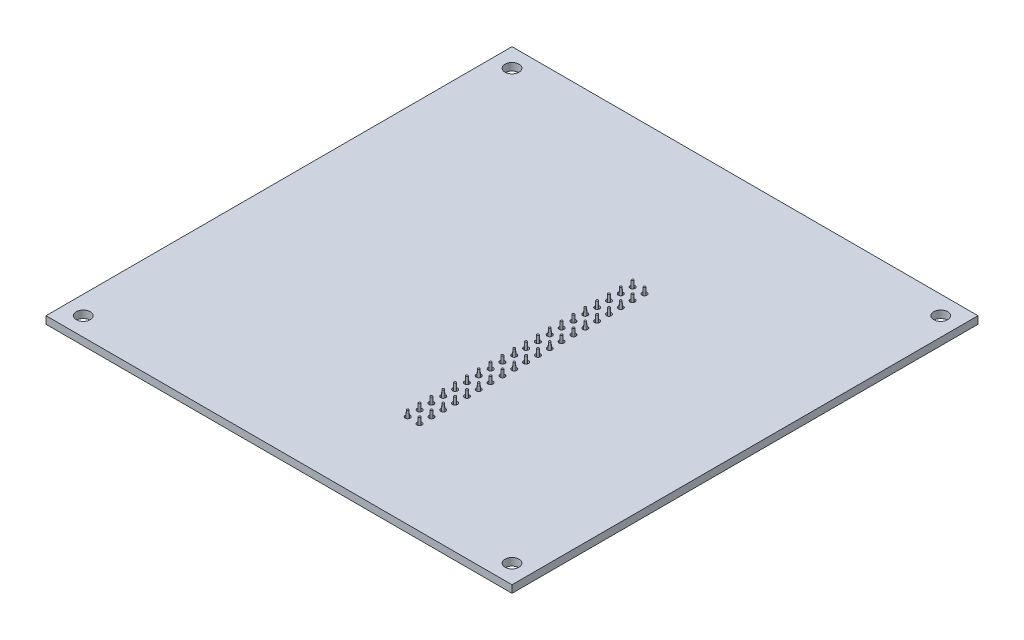
from build123d import *

# Parameters (mm, degrees)
SKETCH1_W               = 100
SKETCH1_H               = 100
BOSS_EXTRUDE1_DEPTH     = 1.6
SKETCH2_R               = 0.535
CUT_EXTRUDE1_DEPTH      = 71.728777736
SKETCH4_W               = 2.54
SKETCH4_H               = 2.54
SKETCH4_W_2             = 1.54
SKETCH4_H_2             = 1.54
BOSS_EXTRUDE2_DEPTH     = 8.4
LPATTERN2_COUNT         = 20
LPATTERN2_PITCH         = 2.54
LPATTERN2_COUNT_DIR2    = 2
LPATTERN2_PITCH_DIR2    = 2.54
SKETCH5_R               = 0.535
BOSS_EXTRUDE3_DEPTH     = 12.3
BOSS_EXTRUDE3_TAPER     = 1.5
BOSS_EXTRUDE3_2_DEPTH   = 12.3
BOSS_EXTRUDE3_2_TAPER   = 1.5
BOSS_EXTRUDE3_3_DEPTH   = 12.3
BOSS_EXTRUDE3_3_TAPER   = 1.5
BOSS_EXTRUDE3_4_DEPTH   = 12.3
BOSS_EXTRUDE3_4_TAPER   = 1.5
BOSS_EXTRUDE3_5_DEPTH   = 12.3
BOSS_EXTRUDE3_5_TAPER   = 1.5
BOSS_EXTRUDE3_6_DEPTH   = 12.3
BOSS_EXTRUDE3_6_TAPER   = 1.5
BOSS_EXTRUDE3_7_DEPTH   = 12.3
BOSS_EXTRUDE3_7_TAPER   = 1.5
BOSS_EXTRUDE3_8_DEPTH   = 12.3
BOSS_EXTRUDE3_8_TAPER   = 1.5
BOSS_EXTRUDE3_9_DEPTH   = 12.3
BOSS_EXTRUDE3_9_TAPER   = 1.5
BOSS_EXTRUDE3_10_DEPTH  = 12.3
BOSS_EXTRUDE3_10_TAPER  = 1.5
BOSS_EXTRUDE3_11_DEPTH  = 12.3
BOSS_EXTRUDE3_11_TAPER  = 1.5
BOSS_EXTRUDE3_12_DEPTH  = 12.3
BOSS_EXTRUDE3_12_TAPER  = 1.5
BOSS_EXTRUDE3_13_DEPTH  = 12.3
BOSS_EXTRUDE3_13_TAPER  = 1.5
BOSS_EXTRUDE3_14_DEPTH  = 12.3
BOSS_EXTRUDE3_14_TAPER  = 1.5
BOSS_EXTRUDE3_15_DEPTH  = 12.3
BOSS_EXTRUDE3_15_TAPER  = 1.5
BOSS_EXTRUDE3_16_DEPTH  = 12.3
BOSS_EXTRUDE3_16_TAPER  = 1.5
BOSS_EXTRUDE3_17_DEPTH  = 12.3
BOSS_EXTRUDE3_17_TAPER  = 1.5
BOSS_EXTRUDE3_18_DEPTH  = 12.3
BOSS_EXTRUDE3_18_TAPER  = 1.5
BOSS_EXTRUDE3_19_DEPTH  = 12.3
BOSS_EXTRUDE3_19_TAPER  = 1.5
BOSS_EXTRUDE3_20_DEPTH  = 12.3
BOSS_EXTRUDE3_20_TAPER  = 1.5
BOSS_EXTRUDE3_21_DEPTH  = 12.3
BOSS_EXTRUDE3_21_TAPER  = 1.5
BOSS_EXTRUDE3_22_DEPTH  = 12.3
BOSS_EXTRUDE3_22_TAPER  = 1.5
BOSS_EXTRUDE3_23_DEPTH  = 12.3
BOSS_EXTRUDE3_23_TAPER  = 1.5
BOSS_EXTRUDE3_24_DEPTH  = 12.3
BOSS_EXTRUDE3_24_TAPER  = 1.5
BOSS_EXTRUDE3_25_DEPTH  = 12.3
BOSS_EXTRUDE3_25_TAPER  = 1.5
BOSS_EXTRUDE3_26_DEPTH  = 12.3
BOSS_EXTRUDE3_26_TAPER  = 1.5
BOSS_EXTRUDE3_27_DEPTH  = 12.3
BOSS_EXTRUDE3_27_TAPER  = 1.5
BOSS_EXTRUDE3_28_DEPTH  = 12.3
BOSS_EXTRUDE3_28_TAPER  = 1.5
BOSS_EXTRUDE3_29_DEPTH  = 12.3
BOSS_EXTRUDE3_29_TAPER  = 1.5
BOSS_EXTRUDE3_30_DEPTH  = 12.3
BOSS_EXTRUDE3_30_TAPER  = 1.5
BOSS_EXTRUDE3_31_DEPTH  = 12.3
BOSS_EXTRUDE3_31_TAPER  = 1.5
BOSS_EXTRUDE3_32_DEPTH  = 12.3
BOSS_EXTRUDE3_32_TAPER  = 1.5
BOSS_EXTRUDE3_33_DEPTH  = 12.3
BOSS_EXTRUDE3_33_TAPER  = 1.5
BOSS_EXTRUDE3_34_DEPTH  = 12.3
BOSS_EXTRUDE3_34_TAPER  = 1.5
BOSS_EXTRUDE3_35_DEPTH  = 12.3
BOSS_EXTRUDE3_35_TAPER  = 1.5
BOSS_EXTRUDE3_36_DEPTH  = 12.3
BOSS_EXTRUDE3_36_TAPER  = 1.5
BOSS_EXTRUDE3_37_DEPTH  = 12.3
BOSS_EXTRUDE3_37_TAPER  = 1.5
BOSS_EXTRUDE3_38_DEPTH  = 12.3
BOSS_EXTRUDE3_38_TAPER  = 1.5
BOSS_EXTRUDE3_39_DEPTH  = 12.3
BOSS_EXTRUDE3_39_TAPER  = 1.5
BOSS_EXTRUDE3_40_DEPTH  = 12.3
BOSS_EXTRUDE3_40_TAPER  = 1.5
CUT_EXTRUDE2_DEPTH      = 74.323666029
CUT_EXTRUDE2_DEPTH_BACK = 74.323666029
SKETCH6_R               = 1.5


with BuildPart() as part:
    # Sketch1 → Boss-Extrude1 (new body)
    with BuildSketch(Plane(origin=(0, 0, 0), x_dir=(1, 0, 0), z_dir=(0, 1, 0))):
        Rectangle(SKETCH1_W, SKETCH1_H)
    extrude(amount=BOSS_EXTRUDE1_DEPTH)

    # Sketch2 → Cut-Extrude1 (cut, through all)
    with BuildSketch(Plane(origin=(0, 1.6, 0), x_dir=(1, 0, 0), z_dir=(0, 1, 0))):
        with Locations((10.138, -29.974)):
            Circle(SKETCH2_R)
        with Locations((7.598, -29.974)):
            Circle(SKETCH2_R)
        with Locations((7.598, -27.434)):
            Circle(SKETCH2_R)
        with Locations((7.598, -24.894)):
            Circle(SKETCH2_R)
        with Locations((7.598, -22.354)):
            Circle(SKETCH2_R)
        with Locations((7.598, -19.814)):
            Circle(SKETCH2_R)
        with Locations((7.598, -17.274)):
            Circle(SKETCH2_R)
        with Locations((7.598, -14.734)):
            Circle(SKETCH2_R)
        with Locations((7.598, -12.194)):
            Circle(SKETCH2_R)
        with Locations((7.598, -9.654)):
            Circle(SKETCH2_R)
        with Locations((7.598, -7.114)):
            Circle(SKETCH2_R)
        with Locations((7.598, -4.574)):
            Circle(SKETCH2_R)
        with Locations((7.598, -2.034)):
            Circle(SKETCH2_R)
        with Locations((7.598, 0.506)):
            Circle(SKETCH2_R)
        with Locations((7.598, 3.046)):
            Circle(SKETCH2_R)
        with Locations((7.598, 5.586)):
            Circle(SKETCH2_R)
        with Locations((7.598, 8.126)):
            Circle(SKETCH2_R)
        with Locations((7.598, 10.666)):
            Circle(SKETCH2_R)
        with Locations((7.598, 13.206)):
            Circle(SKETCH2_R)
        with Locations((7.598, 15.746)):
            Circle(SKETCH2_R)
        with Locations((7.598, 18.286)):
            Circle(SKETCH2_R)
        with Locations((10.138, -27.434)):
            Circle(SKETCH2_R)
        with Locations((10.138, -24.894)):
            Circle(SKETCH2_R)
        with Locations((10.138, -22.354)):
            Circle(SKETCH2_R)
        with Locations((10.138, -19.814)):
            Circle(SKETCH2_R)
        with Locations((10.138, -17.274)):
            Circle(SKETCH2_R)
        with Locations((10.138, -14.734)):
            Circle(SKETCH2_R)
        with Locations((10.138, -12.194)):
            Circle(SKETCH2_R)
        with Locations((10.138, -9.654)):
            Circle(SKETCH2_R)
        with Locations((10.138, -7.114)):
            Circle(SKETCH2_R)
        with Locations((10.138, -4.574)):
            Circle(SKETCH2_R)
        with Locations((10.138, -2.034)):
            Circle(SKETCH2_R)
        with Locations((10.138, 0.506)):
            Circle(SKETCH2_R)
        with Locations((10.138, 3.046)):
            Circle(SKETCH2_R)
        with Locations((10.138, 5.586)):
            Circle(SKETCH2_R)
        with Locations((10.138, 8.126)):
            Circle(SKETCH2_R)
        with Locations((10.138, 10.666)):
            Circle(SKETCH2_R)
        with Locations((10.138, 13.206)):
            Circle(SKETCH2_R)
        with Locations((10.138, 15.746)):
            Circle(SKETCH2_R)
        with Locations((10.138, 18.286)):
            Circle(SKETCH2_R)
    extrude(amount=-CUT_EXTRUDE1_DEPTH, mode=Mode.SUBTRACT)

    # Sketch6 → Cut-Extrude2 (cut, two sides: drawn at the far end of the back side and taken through both)
    with BuildSketch(Plane(origin=(0, 1.6, 0), x_dir=(1, 0, 0), z_dir=(0, 1, 0)).offset(-CUT_EXTRUDE2_DEPTH_BACK)):
        with Locations((-46, 46)):
            Circle(SKETCH6_R)
        with Locations((-46, -46)):
            Circle(SKETCH6_R)
        with Locations((46, -46)):
            Circle(SKETCH6_R)
        with Locations((46, 46)):
            Circle(SKETCH6_R)
    extrude(amount=CUT_EXTRUDE2_DEPTH + CUT_EXTRUDE2_DEPTH_BACK, mode=Mode.SUBTRACT)


with BuildPart() as body_2:
    # Sketch4 → Boss-Extrude2 (new body)
    with BuildSketch(Plane(origin=(0, -9.4, 0), x_dir=(1, 0, 0), z_dir=(0, 1, 0))):
        with Locations((10.138, -29.974)):
            Rectangle(SKETCH4_W, SKETCH4_H)
        with Locations((10.138, -29.974)):
            Rectangle(SKETCH4_W_2, SKETCH4_H_2, mode=Mode.SUBTRACT)
    boss_extrude2 = extrude(amount=-BOSS_EXTRUDE2_DEPTH)

    # LPattern2: Boss-Extrude2 20 × 2
    with Locations(*[(-j * LPATTERN2_PITCH_DIR2, 0, -i * LPATTERN2_PITCH) for i in range(LPATTERN2_COUNT) for j in range(LPATTERN2_COUNT_DIR2) if (i, j) != (0, 0)]):
        add(boss_extrude2)


with BuildPart() as body_3:
    # Sketch5 → Boss-Extrude3 (new body)
    with BuildSketch(Plane(origin=(0, -9.4, 0), x_dir=(-1, 0, 0), z_dir=(0, -1, 0))):
        with Locations((-7.598, 3.046)):
            Circle(SKETCH5_R)
    extrude(amount=-BOSS_EXTRUDE3_DEPTH, taper=BOSS_EXTRUDE3_TAPER)


with BuildPart() as body_4:
    # Sketch5 → Boss-Extrude3 2 (new body)
    with BuildSketch(Plane(origin=(0, -9.4, 0), x_dir=(-1, 0, 0), z_dir=(0, -1, 0))):
        with Locations((-7.598, 5.586)):
            Circle(SKETCH5_R)
    extrude(amount=-BOSS_EXTRUDE3_2_DEPTH, taper=BOSS_EXTRUDE3_2_TAPER)


with BuildPart() as body_5:
    # Sketch5 → Boss-Extrude3 3 (new body)
    with BuildSketch(Plane(origin=(0, -9.4, 0), x_dir=(-1, 0, 0), z_dir=(0, -1, 0))):
        with Locations((-7.598, 8.126)):
            Circle(SKETCH5_R)
    extrude(amount=-BOSS_EXTRUDE3_3_DEPTH, taper=BOSS_EXTRUDE3_3_TAPER)


with BuildPart() as body_6:
    # Sketch5 → Boss-Extrude3 4 (new body)
    with BuildSketch(Plane(origin=(0, -9.4, 0), x_dir=(-1, 0, 0), z_dir=(0, -1, 0))):
        with Locations((-7.598, 10.666)):
            Circle(SKETCH5_R)
    extrude(amount=-BOSS_EXTRUDE3_4_DEPTH, taper=BOSS_EXTRUDE3_4_TAPER)


with BuildPart() as body_7:
    # Sketch5 → Boss-Extrude3 5 (new body)
    with BuildSketch(Plane(origin=(0, -9.4, 0), x_dir=(-1, 0, 0), z_dir=(0, -1, 0))):
        with Locations((-7.598, 13.206)):
            Circle(SKETCH5_R)
    extrude(amount=-BOSS_EXTRUDE3_5_DEPTH, taper=BOSS_EXTRUDE3_5_TAPER)


with BuildPart() as body_8:
    # Sketch5 → Boss-Extrude3 6 (new body)
    with BuildSketch(Plane(origin=(0, -9.4, 0), x_dir=(-1, 0, 0), z_dir=(0, -1, 0))):
        with Locations((-7.598, 15.746)):
            Circle(SKETCH5_R)
    extrude(amount=-BOSS_EXTRUDE3_6_DEPTH, taper=BOSS_EXTRUDE3_6_TAPER)


with BuildPart() as body_9:
    # Sketch5 → Boss-Extrude3 7 (new body)
    with BuildSketch(Plane(origin=(0, -9.4, 0), x_dir=(-1, 0, 0), z_dir=(0, -1, 0))):
        with Locations((-7.598, 18.286)):
            Circle(SKETCH5_R)
    extrude(amount=-BOSS_EXTRUDE3_7_DEPTH, taper=BOSS_EXTRUDE3_7_TAPER)


with BuildPart() as body_10:
    # Sketch5 → Boss-Extrude3 8 (new body)
    with BuildSketch(Plane(origin=(0, -9.4, 0), x_dir=(-1, 0, 0), z_dir=(0, -1, 0))):
        with Locations((-10.138, 18.286)):
            Circle(SKETCH5_R)
    extrude(amount=-BOSS_EXTRUDE3_8_DEPTH, taper=BOSS_EXTRUDE3_8_TAPER)


with BuildPart() as body_11:
    # Sketch5 → Boss-Extrude3 9 (new body)
    with BuildSketch(Plane(origin=(0, -9.4, 0), x_dir=(-1, 0, 0), z_dir=(0, -1, 0))):
        with Locations((-10.138, 15.746)):
            Circle(SKETCH5_R)
    extrude(amount=-BOSS_EXTRUDE3_9_DEPTH, taper=BOSS_EXTRUDE3_9_TAPER)


with BuildPart() as body_12:
    # Sketch5 → Boss-Extrude3 10 (new body)
    with BuildSketch(Plane(origin=(0, -9.4, 0), x_dir=(-1, 0, 0), z_dir=(0, -1, 0))):
        with Locations((-10.138, 13.206)):
            Circle(SKETCH5_R)
    extrude(amount=-BOSS_EXTRUDE3_10_DEPTH, taper=BOSS_EXTRUDE3_10_TAPER)


with BuildPart() as body_13:
    # Sketch5 → Boss-Extrude3 11 (new body)
    with BuildSketch(Plane(origin=(0, -9.4, 0), x_dir=(-1, 0, 0), z_dir=(0, -1, 0))):
        with Locations((-10.138, 10.666)):
            Circle(SKETCH5_R)
    extrude(amount=-BOSS_EXTRUDE3_11_DEPTH, taper=BOSS_EXTRUDE3_11_TAPER)


with BuildPart() as body_14:
    # Sketch5 → Boss-Extrude3 12 (new body)
    with BuildSketch(Plane(origin=(0, -9.4, 0), x_dir=(-1, 0, 0), z_dir=(0, -1, 0))):
        with Locations((-10.138, 8.126)):
            Circle(SKETCH5_R)
    extrude(amount=-BOSS_EXTRUDE3_12_DEPTH, taper=BOSS_EXTRUDE3_12_TAPER)


with BuildPart() as body_15:
    # Sketch5 → Boss-Extrude3 13 (new body)
    with BuildSketch(Plane(origin=(0, -9.4, 0), x_dir=(-1, 0, 0), z_dir=(0, -1, 0))):
        with Locations((-10.138, 5.586)):
            Circle(SKETCH5_R)
    extrude(amount=-BOSS_EXTRUDE3_13_DEPTH, taper=BOSS_EXTRUDE3_13_TAPER)


with BuildPart() as body_16:
    # Sketch5 → Boss-Extrude3 14 (new body)
    with BuildSketch(Plane(origin=(0, -9.4, 0), x_dir=(-1, 0, 0), z_dir=(0, -1, 0))):
        with Locations((-10.138, 3.046)):
            Circle(SKETCH5_R)
    extrude(amount=-BOSS_EXTRUDE3_14_DEPTH, taper=BOSS_EXTRUDE3_14_TAPER)


with BuildPart() as body_17:
    # Sketch5 → Boss-Extrude3 15 (new body)
    with BuildSketch(Plane(origin=(0, -9.4, 0), x_dir=(-1, 0, 0), z_dir=(0, -1, 0))):
        with Locations((-7.598, 0.506)):
            Circle(SKETCH5_R)
    extrude(amount=-BOSS_EXTRUDE3_15_DEPTH, taper=BOSS_EXTRUDE3_15_TAPER)


with BuildPart() as body_18:
    # Sketch5 → Boss-Extrude3 16 (new body)
    with BuildSketch(Plane(origin=(0, -9.4, 0), x_dir=(-1, 0, 0), z_dir=(0, -1, 0))):
        with Locations((-10.138, 0.506)):
            Circle(SKETCH5_R)
    extrude(amount=-BOSS_EXTRUDE3_16_DEPTH, taper=BOSS_EXTRUDE3_16_TAPER)


with BuildPart() as body_19:
    # Sketch5 → Boss-Extrude3 17 (new body)
    with BuildSketch(Plane(origin=(0, -9.4, 0), x_dir=(-1, 0, 0), z_dir=(0, -1, 0))):
        with Locations((-10.138, -2.034)):
            Circle(SKETCH5_R)
    extrude(amount=-BOSS_EXTRUDE3_17_DEPTH, taper=BOSS_EXTRUDE3_17_TAPER)


with BuildPart() as body_20:
    # Sketch5 → Boss-Extrude3 18 (new body)
    with BuildSketch(Plane(origin=(0, -9.4, 0), x_dir=(-1, 0, 0), z_dir=(0, -1, 0))):
        with Locations((-7.598, -2.034)):
            Circle(SKETCH5_R)
    extrude(amount=-BOSS_EXTRUDE3_18_DEPTH, taper=BOSS_EXTRUDE3_18_TAPER)


with BuildPart() as body_21:
    # Sketch5 → Boss-Extrude3 19 (new body)
    with BuildSketch(Plane(origin=(0, -9.4, 0), x_dir=(-1, 0, 0), z_dir=(0, -1, 0))):
        with Locations((-7.598, -4.574)):
            Circle(SKETCH5_R)
    extrude(amount=-BOSS_EXTRUDE3_19_DEPTH, taper=BOSS_EXTRUDE3_19_TAPER)


with BuildPart() as body_22:
    # Sketch5 → Boss-Extrude3 20 (new body)
    with BuildSketch(Plane(origin=(0, -9.4, 0), x_dir=(-1, 0, 0), z_dir=(0, -1, 0))):
        with Locations((-10.138, -4.574)):
            Circle(SKETCH5_R)
    extrude(amount=-BOSS_EXTRUDE3_20_DEPTH, taper=BOSS_EXTRUDE3_20_TAPER)


with BuildPart() as body_23:
    # Sketch5 → Boss-Extrude3 21 (new body)
    with BuildSketch(Plane(origin=(0, -9.4, 0), x_dir=(-1, 0, 0), z_dir=(0, -1, 0))):
        with Locations((-10.138, -7.114)):
            Circle(SKETCH5_R)
    extrude(amount=-BOSS_EXTRUDE3_21_DEPTH, taper=BOSS_EXTRUDE3_21_TAPER)


with BuildPart() as body_24:
    # Sketch5 → Boss-Extrude3 22 (new body)
    with BuildSketch(Plane(origin=(0, -9.4, 0), x_dir=(-1, 0, 0), z_dir=(0, -1, 0))):
        with Locations((-7.598, -7.114)):
            Circle(SKETCH5_R)
    extrude(amount=-BOSS_EXTRUDE3_22_DEPTH, taper=BOSS_EXTRUDE3_22_TAPER)


with BuildPart() as body_25:
    # Sketch5 → Boss-Extrude3 23 (new body)
    with BuildSketch(Plane(origin=(0, -9.4, 0), x_dir=(-1, 0, 0), z_dir=(0, -1, 0))):
        with Locations((-7.598, -9.654)):
            Circle(SKETCH5_R)
    extrude(amount=-BOSS_EXTRUDE3_23_DEPTH, taper=BOSS_EXTRUDE3_23_TAPER)


with BuildPart() as body_26:
    # Sketch5 → Boss-Extrude3 24 (new body)
    with BuildSketch(Plane(origin=(0, -9.4, 0), x_dir=(-1, 0, 0), z_dir=(0, -1, 0))):
        with Locations((-10.138, -9.654)):
            Circle(SKETCH5_R)
    extrude(amount=-BOSS_EXTRUDE3_24_DEPTH, taper=BOSS_EXTRUDE3_24_TAPER)


with BuildPart() as body_27:
    # Sketch5 → Boss-Extrude3 25 (new body)
    with BuildSketch(Plane(origin=(0, -9.4, 0), x_dir=(-1, 0, 0), z_dir=(0, -1, 0))):
        with Locations((-7.598, -12.194)):
            Circle(SKETCH5_R)
    extrude(amount=-BOSS_EXTRUDE3_25_DEPTH, taper=BOSS_EXTRUDE3_25_TAPER)


with BuildPart() as body_28:
    # Sketch5 → Boss-Extrude3 26 (new body)
    with BuildSketch(Plane(origin=(0, -9.4, 0), x_dir=(-1, 0, 0), z_dir=(0, -1, 0))):
        with Locations((-10.138, -12.194)):
            Circle(SKETCH5_R)
    extrude(amount=-BOSS_EXTRUDE3_26_DEPTH, taper=BOSS_EXTRUDE3_26_TAPER)


with BuildPart() as body_29:
    # Sketch5 → Boss-Extrude3 27 (new body)
    with BuildSketch(Plane(origin=(0, -9.4, 0), x_dir=(-1, 0, 0), z_dir=(0, -1, 0))):
        with Locations((-10.138, -14.734)):
            Circle(SKETCH5_R)
    extrude(amount=-BOSS_EXTRUDE3_27_DEPTH, taper=BOSS_EXTRUDE3_27_TAPER)


with BuildPart() as body_30:
    # Sketch5 → Boss-Extrude3 28 (new body)
    with BuildSketch(Plane(origin=(0, -9.4, 0), x_dir=(-1, 0, 0), z_dir=(0, -1, 0))):
        with Locations((-7.598, -14.734)):
            Circle(SKETCH5_R)
    extrude(amount=-BOSS_EXTRUDE3_28_DEPTH, taper=BOSS_EXTRUDE3_28_TAPER)


with BuildPart() as body_31:
    # Sketch5 → Boss-Extrude3 29 (new body)
    with BuildSketch(Plane(origin=(0, -9.4, 0), x_dir=(-1, 0, 0), z_dir=(0, -1, 0))):
        with Locations((-7.598, -17.274)):
            Circle(SKETCH5_R)
    extrude(amount=-BOSS_EXTRUDE3_29_DEPTH, taper=BOSS_EXTRUDE3_29_TAPER)


with BuildPart() as body_32:
    # Sketch5 → Boss-Extrude3 30 (new body)
    with BuildSketch(Plane(origin=(0, -9.4, 0), x_dir=(-1, 0, 0), z_dir=(0, -1, 0))):
        with Locations((-10.138, -17.274)):
            Circle(SKETCH5_R)
    extrude(amount=-BOSS_EXTRUDE3_30_DEPTH, taper=BOSS_EXTRUDE3_30_TAPER)


with BuildPart() as body_33:
    # Sketch5 → Boss-Extrude3 31 (new body)
    with BuildSketch(Plane(origin=(0, -9.4, 0), x_dir=(-1, 0, 0), z_dir=(0, -1, 0))):
        with Locations((-10.138, -19.814)):
            Circle(SKETCH5_R)
    extrude(amount=-BOSS_EXTRUDE3_31_DEPTH, taper=BOSS_EXTRUDE3_31_TAPER)


with BuildPart() as body_34:
    # Sketch5 → Boss-Extrude3 32 (new body)
    with BuildSketch(Plane(origin=(0, -9.4, 0), x_dir=(-1, 0, 0), z_dir=(0, -1, 0))):
        with Locations((-7.598, -19.814)):
            Circle(SKETCH5_R)
    extrude(amount=-BOSS_EXTRUDE3_32_DEPTH, taper=BOSS_EXTRUDE3_32_TAPER)


with BuildPart() as body_35:
    # Sketch5 → Boss-Extrude3 33 (new body)
    with BuildSketch(Plane(origin=(0, -9.4, 0), x_dir=(-1, 0, 0), z_dir=(0, -1, 0))):
        with Locations((-7.598, -22.354)):
            Circle(SKETCH5_R)
    extrude(amount=-BOSS_EXTRUDE3_33_DEPTH, taper=BOSS_EXTRUDE3_33_TAPER)


with BuildPart() as body_36:
    # Sketch5 → Boss-Extrude3 34 (new body)
    with BuildSketch(Plane(origin=(0, -9.4, 0), x_dir=(-1, 0, 0), z_dir=(0, -1, 0))):
        with Locations((-10.138, -22.354)):
            Circle(SKETCH5_R)
    extrude(amount=-BOSS_EXTRUDE3_34_DEPTH, taper=BOSS_EXTRUDE3_34_TAPER)


with BuildPart() as body_37:
    # Sketch5 → Boss-Extrude3 35 (new body)
    with BuildSketch(Plane(origin=(0, -9.4, 0), x_dir=(-1, 0, 0), z_dir=(0, -1, 0))):
        with Locations((-7.598, -24.894)):
            Circle(SKETCH5_R)
    extrude(amount=-BOSS_EXTRUDE3_35_DEPTH, taper=BOSS_EXTRUDE3_35_TAPER)


with BuildPart() as body_38:
    # Sketch5 → Boss-Extrude3 36 (new body)
    with BuildSketch(Plane(origin=(0, -9.4, 0), x_dir=(-1, 0, 0), z_dir=(0, -1, 0))):
        with Locations((-10.138, -24.894)):
            Circle(SKETCH5_R)
    extrude(amount=-BOSS_EXTRUDE3_36_DEPTH, taper=BOSS_EXTRUDE3_36_TAPER)


with BuildPart() as body_39:
    # Sketch5 → Boss-Extrude3 37 (new body)
    with BuildSketch(Plane(origin=(0, -9.4, 0), x_dir=(-1, 0, 0), z_dir=(0, -1, 0))):
        with Locations((-7.598, -27.434)):
            Circle(SKETCH5_R)
    extrude(amount=-BOSS_EXTRUDE3_37_DEPTH, taper=BOSS_EXTRUDE3_37_TAPER)


with BuildPart() as body_40:
    # Sketch5 → Boss-Extrude3 38 (new body)
    with BuildSketch(Plane(origin=(0, -9.4, 0), x_dir=(-1, 0, 0), z_dir=(0, -1, 0))):
        with Locations((-10.138, -27.434)):
            Circle(SKETCH5_R)
    extrude(amount=-BOSS_EXTRUDE3_38_DEPTH, taper=BOSS_EXTRUDE3_38_TAPER)


with BuildPart() as body_41:
    # Sketch5 → Boss-Extrude3 39 (new body)
    with BuildSketch(Plane(origin=(0, -9.4, 0), x_dir=(-1, 0, 0), z_dir=(0, -1, 0))):
        with Locations((-10.138, -29.974)):
            Circle(SKETCH5_R)
    extrude(amount=-BOSS_EXTRUDE3_39_DEPTH, taper=BOSS_EXTRUDE3_39_TAPER)


with BuildPart() as body_42:
    # Sketch5 → Boss-Extrude3 40 (new body)
    with BuildSketch(Plane(origin=(0, -9.4, 0), x_dir=(-1, 0, 0), z_dir=(0, -1, 0))):
        with Locations((-7.598, -29.974)):
            Circle(SKETCH5_R)
    extrude(amount=-BOSS_EXTRUDE3_40_DEPTH, taper=BOSS_EXTRUDE3_40_TAPER)


solid = Compound([part.part, body_2.part, body_3.part, body_4.part, body_5.part, body_6.part, body_7.part, body_8.part, body_9.part, body_10.part, body_11.part, body_12.part, body_13.part, body_14.part, body_15.part, body_16.part, body_17.part, body_18.part, body_19.part, body_20.part, body_21.part, body_22.part, body_23.part, body_24.part, body_25.part, body_26.part, body_27.part, body_28.part, body_29.part, body_30.part, body_31.part, body_32.part, body_33.part, body_34.part, body_35.part, body_36.part, body_37.part, body_38.part, body_39.part, body_40.part, body_41.part, body_42.part])
